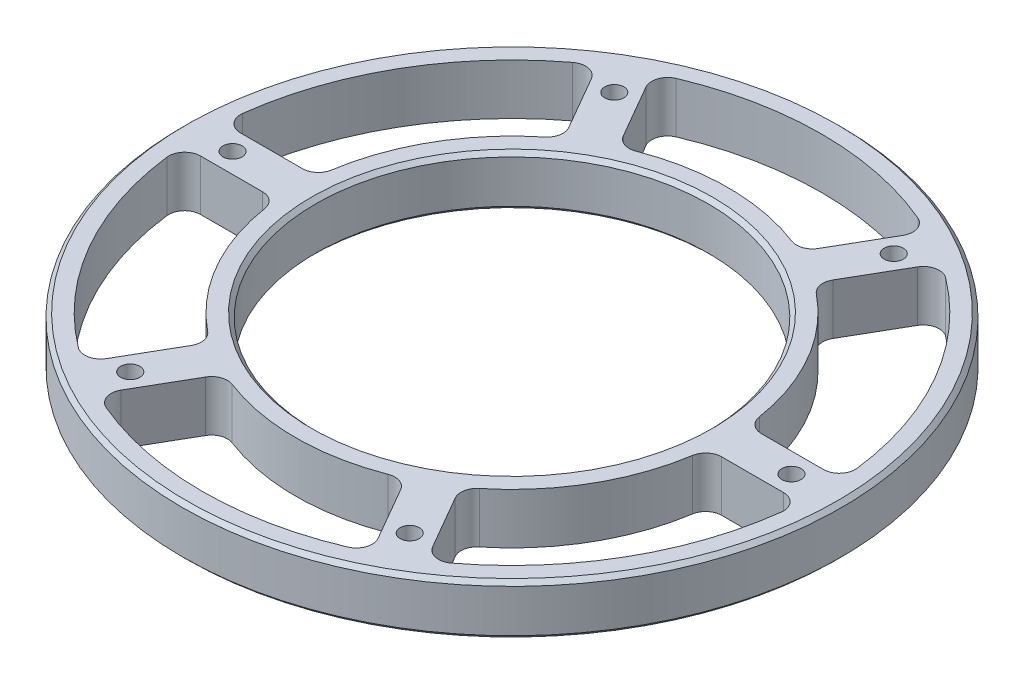
from build123d import *

# Parameters (mm, degrees)
F_12_0_189_DIAMETER_HOLE1_D = 4.8006
CIRPATTERN3_COUNT           = 6
CUT_EXTRUDE1_DEPTH          = 118.43208675655899
FILLET1_R                   = 4
CIRPATTERN4_COUNT           = 6
FILLET1_OF_CIRPATTERN4_R    = 4
CHAMFER1_SIZE               = 1
CHAMFER2_SIZE               = 1


with BuildPart() as part:
    # Sketch2 → Revolve1 (revolve)
    with BuildSketch(Plane(origin=(0, 0, 0), x_dir=(0, 0, -1), z_dir=(1, 0, 0))):
        Polygon((-49.2125, -4.7e-16), (-82.55, -4.08e-15), (-82.55, 12.699999999999996), (-49.2125, 12.699999999999996), align=None)
    revolve(axis=Axis((0, -0.6350000000000036, 0), (0, 1, 0)))

    # #12 (0.189) Diameter Hole1 (through all)
    with Locations(Plane(origin=(0, 12.699999999999996, 0), x_dir=(1, 0, 0), z_dir=(0, 1, 0))):
        with Locations((-35, 60.621778265)):
            f_12_0_189_diameter_hole1 = Hole(F_12_0_189_DIAMETER_HOLE1_D / 2)

    # CirPattern3: #12 (0.189) Diameter Hole1 ×6 about axis
    cirpattern3_axis = Axis((0, -0.6350000000000036, 0), (0, 1, 0))
    for i in range(1, CIRPATTERN3_COUNT):
        add(f_12_0_189_diameter_hole1.rotate(cirpattern3_axis, i * 360 / CIRPATTERN3_COUNT), mode=Mode.SUBTRACT)

    # Sketch8 → Cut-Extrude1 (cut, through all)
    with BuildSketch(Plane(origin=(0, 12.699999999999996, 0), x_dir=(1, 0, 0), z_dir=(0, 1, 0))):
        with BuildLine():
            Line((-22.660589701137386, 49.24929269184184), (-34.36419588509058, 69.52053323422602))
            ThreePointArc((-34.36419588509058, 69.52053323422602), (4.75e-15, 77.55000000000001), (34.36419588509058, 69.52053323422602))
            Line((34.36419588509058, 69.52053323422602), (22.660589701137386, 49.24929269184184))
            ThreePointArc((22.660589701137386, 49.24929269184184), (3.32e-15, 54.2125), (-22.660589701137386, 49.24929269184184))
        make_face()
    cut_extrude1 = extrude(amount=-CUT_EXTRUDE1_DEPTH, mode=Mode.SUBTRACT)

    # Fillet1
    fillet1_edges = [part.edges().sort_by_distance(p)[0] for p in [
        (-22.660589701137383, 6.349999999999998, -49.24929269184184),
        (22.66058970113739, 6.349999999999998, -49.249292691841845),
        (34.36419588509058, 6.349999999999998, -69.52053323422604),
        (-34.36419588509058, 6.349999999999998, -69.52053323422604),
    ]]
    fillet(fillet1_edges, radius=FILLET1_R)

    # CirPattern4: Cut-Extrude1 ×6 about axis
    cirpattern4_axis = Axis((0, -0.6350000000000036, 0), (0, 1, 0))
    for i in range(1, CIRPATTERN4_COUNT):
        add(cut_extrude1.rotate(cirpattern4_axis, i * 360 / CIRPATTERN4_COUNT), mode=Mode.SUBTRACT)

    # Fillet1 of CirPattern4
    fillet1_of_cirpattern4_edges = [part.edges().sort_by_distance(p)[0] for p in [
        (-53.98143344011902, 6.349999999999998, -4.9999999999999325),
        (-31.320843738981637, 6.349999999999998, -44.24929269184193),
        (-43.02444992293479, 6.349999999999998, -64.52053323422614),
        (-77.38864580802537, 6.349999999999998, -4.999999999999911),
        (-31.32084373898165, 6.349999999999998, 44.2492926918419),
        (-53.981433440119034, 6.349999999999998, 4.999999999999911),
        (-77.38864580802539, 6.349999999999998, 4.999999999999886),
        (-43.024449922934814, 6.349999999999998, 64.52053323422612),
        (22.660589701137376, 6.349999999999998, 49.24929269184184),
        (-22.660589701137397, 6.349999999999998, 49.249292691841845),
        (-34.36419588509059, 6.349999999999998, 69.52053323422604),
        (34.364195885090574, 6.349999999999998, 69.52053323422604),
        (53.98143344011902, 6.349999999999998, 4.999999999999954),
        (31.320843738981615, 6.349999999999998, 44.24929269184194),
        (43.024449922934764, 6.349999999999998, 64.52053323422615),
        (77.38864580802537, 6.349999999999998, 4.99999999999994),
        (31.320843738981637, 6.349999999999998, -44.249292691841916),
        (53.981433440119034, 6.349999999999998, -4.9999999999999325),
        (77.38864580802537, 6.349999999999998, -4.999999999999911),
        (43.02444992293479, 6.349999999999998, -64.52053323422614),
    ]]
    fillet(fillet1_of_cirpattern4_edges, radius=FILLET1_OF_CIRPATTERN4_R)

    # Chamfer1
    chamfer1_edges = [part.edges().sort_by_distance(p)[0] for p in [
        (6.03e-15, 12.699999999999996, -49.2125),
        (6.03e-15, -4.4e-16, -49.2125),
    ]]
    chamfer(chamfer1_edges, length=CHAMFER1_SIZE)

    # Chamfer2
    chamfer2_edges = [part.edges().sort_by_distance(p)[0] for p in [
        (4.677e-14, 12.699999999999996, -82.55),
        (4.677e-14, -4.11e-15, -82.55),
    ]]
    chamfer(chamfer2_edges, length=CHAMFER2_SIZE)


solid = part.part
